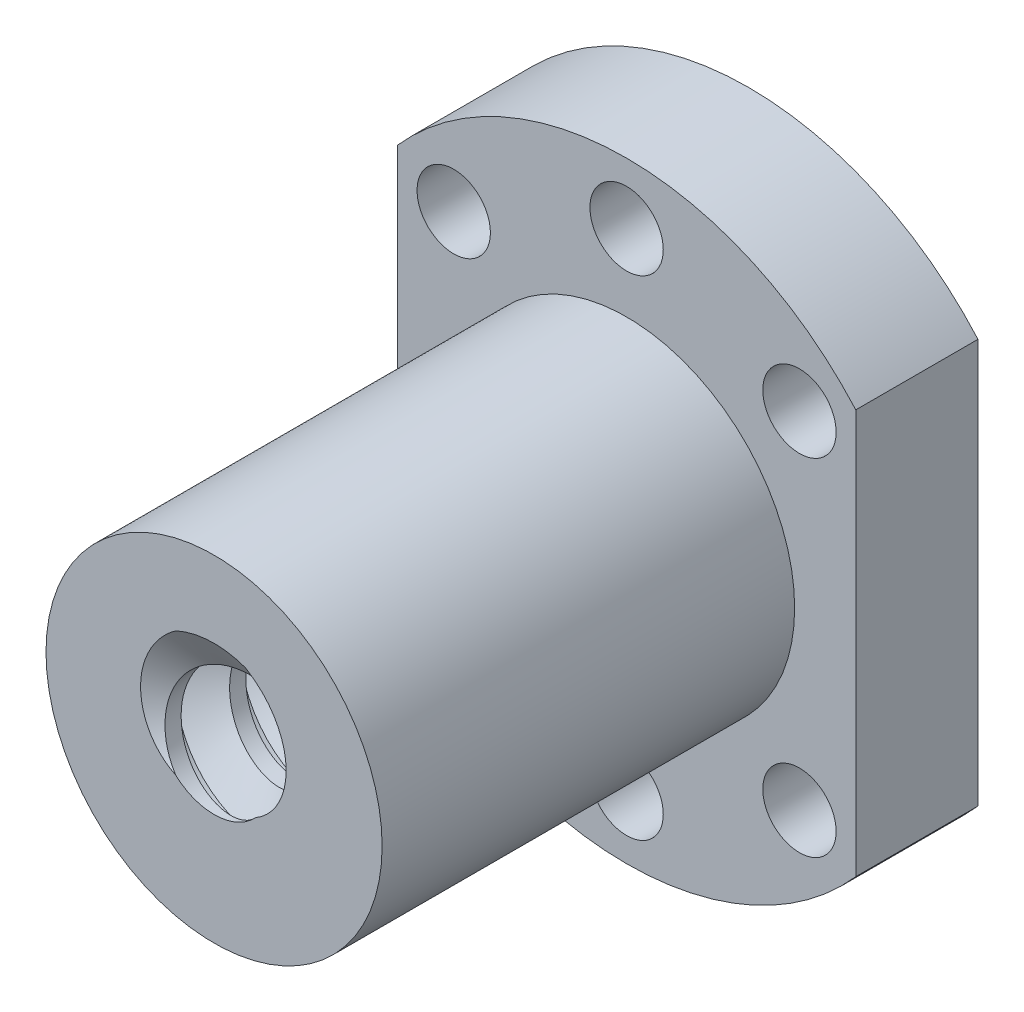
from build123d import *

# Parameters (mm, degrees)
BOSS_EXTRUDE1_DEPTH = 8
SKETCH2_R           = 11
BOSS_EXTRUDE2_DEPTH = 27
SKETCH3_R           = 6
CUT_EXTRUDE1_DEPTH  = 44.011626335
SKETCH4_R           = 2.4
CUT_EXTRUDE2_DEPTH  = 37.796738986
THREAD1_PITCH       = 4.233333333
THREAD1_FROM        = 5
THREAD1_TO          = 40


with BuildPart() as part:
    # Sketch1 → Boss-Extrude1 (new body)
    with BuildSketch(Plane.XY):
        with BuildLine():
            Line((15, -13.228756555), (15, 13.228756555))
            ThreePointArc((15, 13.228756555), (0, 20), (-15, 13.228756555))
            Line((-15, 13.228756555), (-15, -13.228756555))
            ThreePointArc((-15, -13.228756555), (0, -20), (15, -13.228756555))
        make_face()
    extrude(amount=BOSS_EXTRUDE1_DEPTH)

    # Sketch2 → Boss-Extrude2 (add)
    with BuildSketch(Plane.XY.offset(8)):
        Circle(SKETCH2_R)
    extrude(amount=BOSS_EXTRUDE2_DEPTH)

    # Sketch3 → Cut-Extrude1 (cut, through all)
    with BuildSketch(Plane.XY.offset(35)):
        Circle(SKETCH3_R)
    extrude(amount=-CUT_EXTRUDE1_DEPTH, mode=Mode.SUBTRACT)

    # Sketch4 → Cut-Extrude2 (cut, through all)
    with BuildSketch(Plane.XY.offset(8)):
        with Locations((0, 16)):
            Circle(SKETCH4_R)
        with Locations((-11.313708499, 11.313708499)):
            Circle(SKETCH4_R)
        with Locations((11.313708499, 11.313708499)):
            Circle(SKETCH4_R)
        with Locations((11.313708499, -11.313708499)):
            Circle(SKETCH4_R)
        with Locations((0, -16)):
            Circle(SKETCH4_R)
        with Locations((-11.313708499, -11.313708499)):
            Circle(SKETCH4_R)
    extrude(amount=-CUT_EXTRUDE2_DEPTH, mode=Mode.SUBTRACT)

    # Thread1: arcs per turn and ends read off the stored shape
    # Thread1: the profile of Thread Profile1 profile screwed along a right-hand helix through 9.448819 turns, 12 arcs to a turn; built about Z, then put on its axis
    thread1_z = Axis((0, 0, 0), (0, 0, 1))
    thread1_corners = [(6.0003, 0, -0.000173205), (6.0003, 0, 3.70433986), (3.708641129, 0, 2.381249994), (3.708641129, 0, 1.322916661)]
    with BuildLine(mode=Mode.PRIVATE) as thread1_profile:
        Line(thread1_corners[0], thread1_corners[1])
        Line(thread1_corners[1], thread1_corners[2])
        Line(thread1_corners[2], thread1_corners[3])
        Line(thread1_corners[3], thread1_corners[0])
    thread1_cap = Face(thread1_profile.wire())
    thread1_turn_angles = [0, 15, 30, 45, 60, 75, 90, 105, 120, 135, 150, 165, 180, 195, 210, 225, 240, 255, 270, 285, 300, 315, 330, 345, 360]
    thread1_turn_weights = [1, 0.9659258262890683, 1, 0.9659258262890683, 1, 0.9659258262890683, 1, 0.9659258262890683, 1, 0.9659258262890683, 1, 0.9659258262890683, 1, 0.9659258262890683, 1, 0.9659258262890683, 1, 0.9659258262890683, 1, 0.9659258262890683, 1, 0.9659258262890683, 1, 0.9659258262890683, 1]
    thread1_turn_rails = [Edge.make_bspline([Vector(p[0], p[1], 0).rotate(thread1_z, thread1_turn_angles[k]) / thread1_turn_weights[k] + Vector(0, 0, p[2] + THREAD1_PITCH * thread1_turn_angles[k] / 360) for k in range(25)], [0, 0, 0, 1, 1, 2, 2, 3, 3, 4, 4, 5, 5, 6, 6, 7, 7, 8, 8, 9, 9, 10, 10, 11, 11, 12, 12, 12], 2, thread1_turn_weights) for p in thread1_corners]
    thread1_turn_sides = [Face.make_surface_from_curves(thread1_turn_rails[p[0]], thread1_turn_rails[p[1]]) for p in [(0, 1), (1, 2), (2, 3), (3, 0)]]
    thread1_last_angles = [3240, 3255, 3270, 3285, 3300, 3315, 3330, 3345, 3360, 3375, 3390, 3395.787401575, 3401.57480315]
    thread1_last_weights = [1, 0.9659258262890683, 1, 0.9659258262890683, 1, 0.9659258262890683, 1, 0.9659258262890683, 1, 0.9659258262890683, 1, 0.9949029054407533, 1]
    thread1_last_rails = [Edge.make_bspline([Vector(p[0], p[1], 0).rotate(thread1_z, thread1_last_angles[k]) / thread1_last_weights[k] + Vector(0, 0, p[2] + THREAD1_PITCH * thread1_last_angles[k] / 360) for k in range(13)], [0, 0, 0, 1, 1, 2, 2, 3, 3, 4, 4, 5, 5, 6, 6, 6], 2, thread1_last_weights) for p in thread1_corners]
    thread1_last_sides = [Face.make_surface_from_curves(thread1_last_rails[p[0]], thread1_last_rails[p[1]]) for p in [(0, 1), (1, 2), (2, 3), (3, 0)]]
    thread1 = Plane(origin=(0, 0, 40), x_dir=(-1, 0, 0), z_dir=(0, 0, -1)) * split(split(Solid(Shell([*[p.moved(Location((0, 0, THREAD1_PITCH * i))) for i in range(9) for p in thread1_turn_sides], *thread1_last_sides, thread1_cap, thread1_cap.rotate(thread1_z, 3401.57480315).moved(Location((0, 0, THREAD1_PITCH * 3401.57480315 / 360)))])), bisect_by=Plane.XY.offset(THREAD1_FROM), keep=Keep.TOP, mode=Mode.PRIVATE), bisect_by=Plane.XY.offset(THREAD1_TO), keep=Keep.BOTTOM, mode=Mode.PRIVATE)
    add(thread1)


solid = part.part
